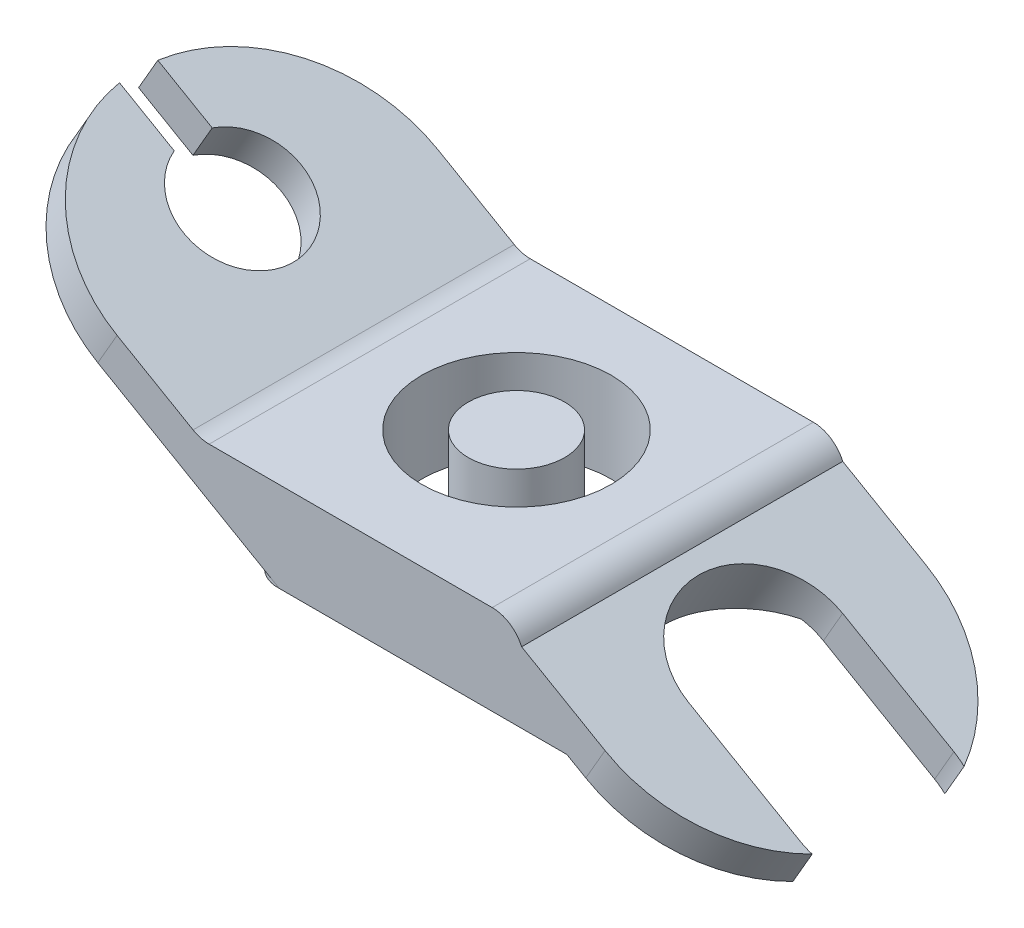
from build123d import *

# Parameters (mm, degrees)
BOSS_EXTRUDE1_DEPTH = 50
FILLET1_R           = 25
FILLET2_R           = 5
FILLET3_R           = 5
CUT_EXTRUDE1_START  = -6
CUT_EXTRUDE1_DEPTH  = 6
SKETCH3_R           = 14.739524533
SKETCH3_R_2         = 7.5
CUT_EXTRUDE2_DEPTH  = 50
CUT_EXTRUDE3_DEPTH  = 50


# Read off the part's stored shape, not the designer's step: Cut-Extrude1
# Some blends are built 0.0001 mm under size
with BuildPart() as part:
    # Sketch1 → Boss-Extrude1 (new body)
    with BuildSketch(Plane.XY):
        Polygon((0, 0), (50, 0), (74.588457268, -14.196152423), (77.588457268, -9), (42.947441117, 11), (42.947441117, 14), (-7.052558883, 14), (-41.693575035, 34), (-44.693575035, 28.803847577), (0, 3), align=None)
    extrude(amount=BOSS_EXTRUDE1_DEPTH)

    # Fillet1
    fillet1_edges = [part.edges().sort_by_distance(p)[0] for p in [
        (76.088457268, -11.598076211, 0),
        (76.088457268, -11.598076211, 50),
        (-43.193575035, 31.401923789, 0),
        (-43.193575035, 31.401923789, 50),
    ]]
    fillet(fillet1_edges, radius=FILLET1_R - 0.0001)  # a hair under: the kernel refuses the full size

    # Fillet2
    # the kernel refuses this fillet: 5 mm, written as the material it takes off along each edge
    with BuildSketch(Plane(origin=(42.947441117, 14, -11.456439237), x_dir=(0, -1, 0), z_dir=(0, 0, 1))) as fillet2_piece_1:
        with BuildLine():
            CenterArc((5, -4.582575695), FILLET2_R, 113.578178478, 66.421821522)
            Line((0, -4.582575695), (-0.1, -4.582575695))
            Line((-0.1, -4.582575695), (-0.1, 0))
            Line((-0.1, 0), (0, 0.1))
            ThreePointArc((0, 0.1), (1.5, 0.1), (2.96, 0.091651514))
            Line((2.96, 0.091651514), (3, 0))
        make_face()
    extrude(amount=72.912878475, mode=Mode.SUBTRACT)

    # Fillet3
    fillet3_edges = [part.edges().sort_by_distance(p)[0] for p in [
        (-7.052558883, 14, 25),
        (0, 1.5, 50),
    ]]
    fillet(fillet3_edges, radius=FILLET3_R)

    # Cut-Extrude1 outline → Cut-Extrude1 (cut)
    with BuildSketch(Plane(origin=(4.299038106, 7.446152423, 0), x_dir=(0.8660254037844423, -0.4999999999999939, 0), z_dir=(0.4999999999999939, 0.8660254037844423, 0)).offset(CUT_EXTRUDE1_START)):
        with BuildLine():
            Line((-54, -28.145870627), (-43.066723537, -28.145870627))
            ThreePointArc((-43.066723537, -28.145870627), (-25.273308711, -24.845643163), (-43.167674884, -22.145870627))
            Line((-43.167674884, -22.145870627), (-54, -22.145870627))
            Line((-54, -22.145870627), (-54, -28.145870627))
        make_face()
    extrude(amount=CUT_EXTRUDE1_DEPTH, mode=Mode.SUBTRACT)

    # Sketch3 → Cut-Extrude2 (cut)
    with BuildSketch(Plane(origin=(0, 14, 0), x_dir=(1, 0, 0), z_dir=(0, 1, 0))):
        with Locations(Location((16.287187079, -24.141274019, 0), (0, 0, 180))):
            Circle(SKETCH3_R)
        with Locations(Location((16.287187079, -24.141274019, 0), (0, 0, 180))):
            Circle(SKETCH3_R_2, mode=Mode.SUBTRACT)
    extrude(amount=-CUT_EXTRUDE2_DEPTH, mode=Mode.SUBTRACT)


with BuildPart() as cut_extrude2_piece_1:
    # of the separate pieces the step leaves, piece 1, a body of its own (cut_extrude2_pieces)
    add(part.part.solids().sort_by_distance((-8.212812921, 14.669872981, 0))[0])

    # Sketch4 → Cut-Extrude3 (cut)
    with BuildSketch(Plane(origin=(15.5, 26.846787517, 0), x_dir=(0.8660254037844423, -0.49999999999999384, 0), z_dir=(0.49999999999999384, 0.8660254037844423, 0))):
        with BuildLine():
            Line((46.693575035, -13), (66.693575035, -13))
            ThreePointArc((66.693575035, -13), (78.693575035, -25), (66.693575035, -37))
            Line((66.693575035, -37), (46.693575035, -37))
            ThreePointArc((46.693575035, -37), (34.693575035, -25), (46.693575035, -13))
        make_face()
    extrude(amount=-CUT_EXTRUDE3_DEPTH, mode=Mode.SUBTRACT)


with BuildPart() as cut_extrude2_piece_2:
    # of the separate pieces the step leaves, piece 2, a body of its own (cut_extrude2_pieces)
    add(part.part.solids().sort_by_distance((8.787187079, 14, 24.141274019))[0])


solid = Compound([cut_extrude2_piece_1.part, cut_extrude2_piece_2.part])
